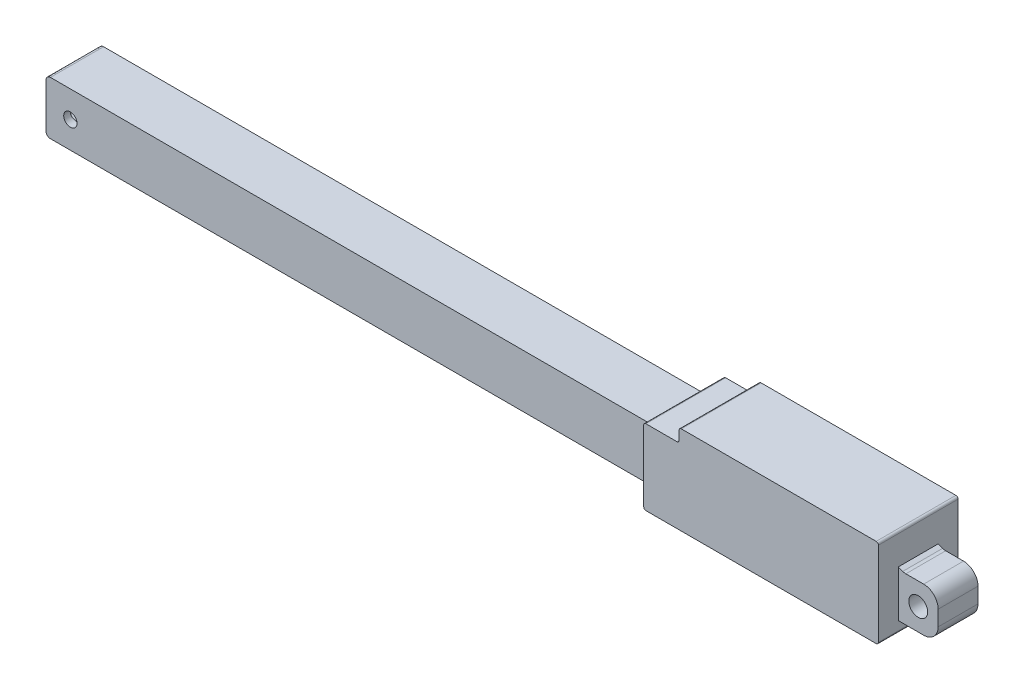
from build123d import *

# Parameters (mm, degrees)
BOSS_EXTRUDE1_DEPTH = 9
SKETCH2_3_W         = 136
SKETCH2_3_H         = 12
SKETCH2_3_R         = 1.5
BOSS_EXTRUDE2_DEPTH = 6
BOSS_EXTRUDE3_DEPTH = 6
SKETCH2_5_R         = 2.125
BOSS_EXTRUDE4_DEPTH = 4.5
SKETCH7_R           = 4.5
CUT_EXTRUDE4_DEPTH  = 138


with BuildPart() as part:
    # Sketch2 → Boss-Extrude1 (new, symmetric)
    with BuildSketch(Plane.XY):
        with BuildLine():
            Line((138, 14), (138, 12))
            Line((138, 12), (138, 0))
            Line((138, 0), (138, -2))
            ThreePointArc((138, -2), (138.146446609, -2.353553391), (138.5, -2.5))
            Line((138.5, -2.5), (190.5, -2.5))
            ThreePointArc((190.5, -2.5), (190.853553391, -2.353553391), (191, -2))
            Line((191, -2), (191, 0))
            Line((191, 0), (191, 10.5))
            Line((191, 10.5), (191, 17))
            ThreePointArc((191, 17), (190.853553391, 17.353553391), (190.5, 17.5))
            Line((190.5, 17.5), (146.5, 17.5))
            ThreePointArc((146.5, 17.5), (146.146446609, 17.353553391), (146, 17))
            Line((146, 17), (146, 15))
            ThreePointArc((146, 15), (145.853553391, 14.646446609), (145.5, 14.5))
            Line((145.5, 14.5), (138.5, 14.5))
            ThreePointArc((138.5, 14.5), (138.146446609, 14.353553391), (138, 14))
        make_face()
    extrude(amount=BOSS_EXTRUDE1_DEPTH, both=True)

    # Sketch2<3> → Boss-Extrude2 (add, symmetric)
    with BuildSketch(Plane.XY):
        with Locations((70, 6)):
            Rectangle(SKETCH2_3_W, SKETCH2_3_H)
        with Locations((5.5, 6)):
            Circle(SKETCH2_3_R, mode=Mode.SUBTRACT)
    extrude(amount=BOSS_EXTRUDE2_DEPTH, both=True)

    # Sketch2<4> → Boss-Extrude3 (add, symmetric)
    with BuildSketch(Plane.XY):
        with BuildLine():
            Line((2, 0), (2, 12))
            Line((2, 12), (1, 12))
            ThreePointArc((1, 12), (0.292893219, 11.707106781), (0, 11))
            Line((0, 11), (0, 1))
            ThreePointArc((0, 1), (0.292893219, 0.292893219), (1, 0))
            Line((1, 0), (2, 0))
        make_face()
    extrude(amount=BOSS_EXTRUDE3_DEPTH, both=True)

    # Sketch2<5> → Boss-Extrude4 (add, symmetric)
    with BuildSketch(Plane.XY):
        with BuildLine():
            Line((191, 10.5), (191, 0))
            Line((191, 0), (196.731658699, 0))
            ThreePointArc((196.731658699, 0), (199.042724996, 0.957275004), (200, 3.268341301))
            Line((200, 3.268341301), (200, 6.731658699))
            ThreePointArc((200, 6.731658699), (199.042724996, 9.042724996), (196.731658699, 10))
            Line((196.731658699, 10), (192.699864582, 10))
            ThreePointArc((192.699864582, 10), (192.344266481, 10.031866369), (192, 10.126450009))
            Line((192, 10.126450009), (191, 10.5))
        make_face()
        with Locations((195.5, 5)):
            Circle(SKETCH2_5_R, mode=Mode.SUBTRACT)
    extrude(amount=BOSS_EXTRUDE4_DEPTH, both=True)

    # Sketch7 → Cut-Extrude4 (cut)
    with BuildSketch(Plane.ZY):
        with Locations((0, 6)):
            Circle(SKETCH7_R)
    extrude(amount=-CUT_EXTRUDE4_DEPTH, mode=Mode.SUBTRACT)


solid = part.part
